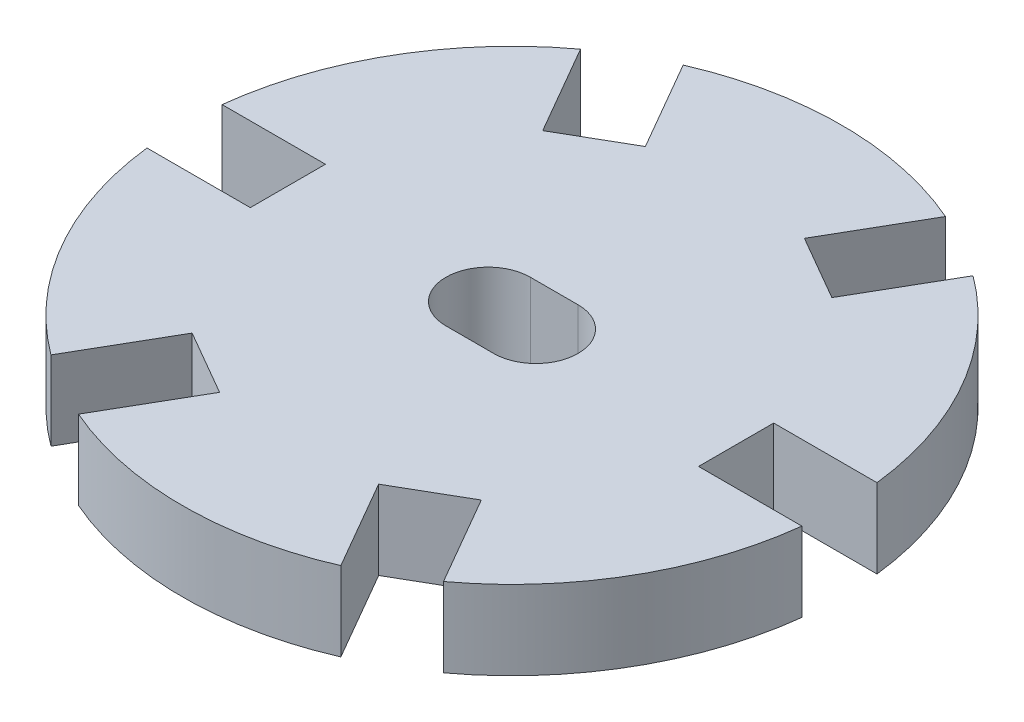
from build123d import *

# Parameters (mm, degrees)
BOSS_EXTRUDE1_DEPTH      = 1.5
BOSS_EXTRUDE1_DEPTH_BACK = 1.5
SKETCH1_R                = 12.5
SKETCH2_W                = 8
SKETCH2_H                = 2.85
CUT_EXTRUDE1_DEPTH       = 18.930421077
CUT_EXTRUDE2_DEPTH       = 18.683873303
CUT_EXTRUDE2_DEPTH_BACK  = 18.683873303


with BuildPart() as part:
    # Sketch1 → Boss-Extrude1 (new, two sides: drawn at the far end of the back side and taken through both)
    with BuildSketch(Plane(origin=(0, 0, 0), x_dir=(1, 0, 0), z_dir=(0, 1, 0)).offset(-BOSS_EXTRUDE1_DEPTH_BACK)):
        Circle(SKETCH1_R)
    extrude(amount=BOSS_EXTRUDE1_DEPTH + BOSS_EXTRUDE1_DEPTH_BACK)

    # Sketch2 → Cut-Extrude1 (cut, through all)
    with BuildSketch(Plane(origin=(0, 1.5, 0), x_dir=(1, 0, 0), z_dir=(0, 1, 0))):
        Polygon((9.4840862, 13.576919162), (5.4840862, 6.648715932), (3.0159138, 8.073715932), (7.0159138, 15.001919162), align=None)
        with Locations((12.5, 0)):
            Rectangle(SKETCH2_W, SKETCH2_H)
        Polygon((-7.0159138, 15.001919162), (-3.0159138, 8.073715932), (-5.4840862, 6.648715932), (-9.4840862, 13.576919162), align=None)
        with Locations((-12.5, 0)):
            Rectangle(SKETCH2_W, SKETCH2_H)
        Polygon((-9.4840862, -13.576919162), (-5.4840862, -6.648715932), (-3.0159138, -8.073715932), (-7.0159138, -15.001919162), align=None)
        Polygon((7.0159138, -15.001919162), (3.0159138, -8.073715932), (5.4840862, -6.648715932), (9.4840862, -13.576919162), align=None)
    extrude(amount=-CUT_EXTRUDE1_DEPTH, mode=Mode.SUBTRACT)

    # Sketch3 → Cut-Extrude2 (cut, two sides: drawn at the far end of the back side and taken through both)
    with BuildSketch(Plane(origin=(0, 0, 0), x_dir=(1, 0, 0), z_dir=(0, 1, 0)).offset(-CUT_EXTRUDE2_DEPTH_BACK)):
        with BuildLine():
            Line((-0.905508436, 1.6), (0.905508436, 1.6))
            ThreePointArc((0.905508436, 1.6), (2.505508436, 0), (0.905508436, -1.6))
            Line((0.905508436, -1.6), (-0.905508436, -1.6))
            ThreePointArc((-0.905508436, -1.6), (-2.505508436, 0), (-0.905508436, 1.6))
        make_face()
    extrude(amount=CUT_EXTRUDE2_DEPTH + CUT_EXTRUDE2_DEPTH_BACK, mode=Mode.SUBTRACT)


solid = part.part
